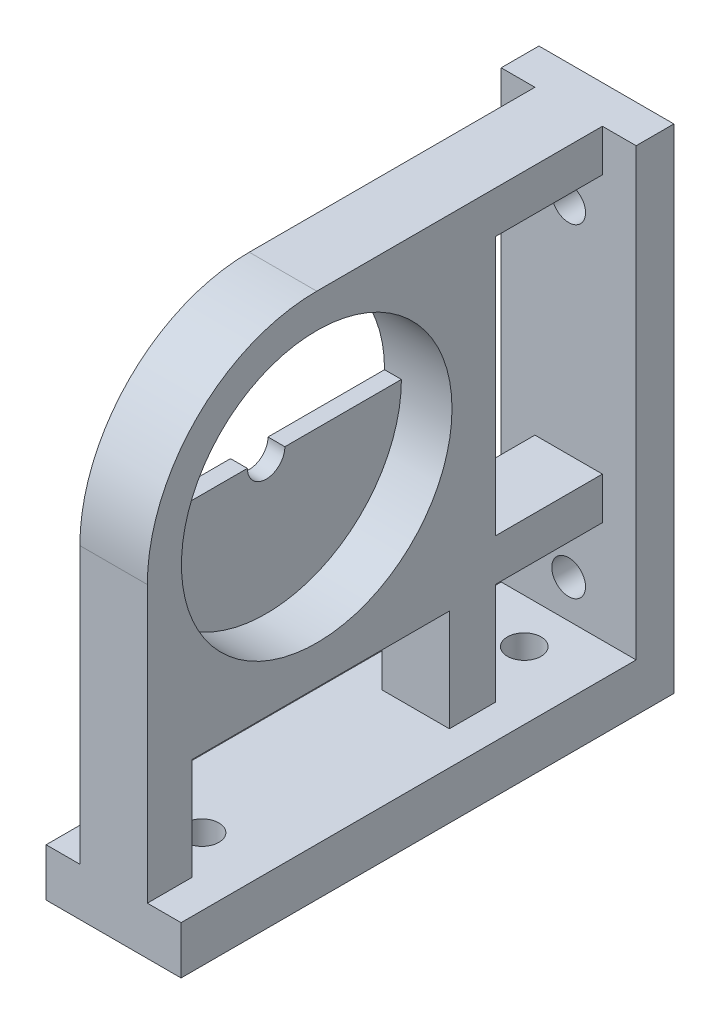
from build123d import *

# Parameters (mm, degrees)
SKETCH1_R                = 25.4635
BOSS_EXTRUDE1_DEPTH      = 12.7
BOSS_EXTRUDE2_DEPTH      = 6.35
BOSS_EXTRUDE2_DEPTH_BACK = 19.05
SKETCH4_W                = 20.078494948
SKETCH4_H                = 48.78095735
SKETCH4_W_2              = 48.420880553
SKETCH4_H_2              = 19.195923741
CUT_EXTRUDE2_DEPTH       = 26.162
SKETCH5_R                = 3.175
CUT_EXTRUDE3_DEPTH       = 11.43
SKETCH6_R                = 3.175
CUT_EXTRUDE4_DEPTH       = 11.43
BOSS_EXTRUDE3_DEPTH      = 3.175


with BuildPart() as part:
    # Sketch1 → Boss-Extrude1 (new body)
    with BuildSketch(Plane(origin=(0, 0, 0), x_dir=(0, 0, -1), z_dir=(1, 0, 0))):
        with BuildLine():
            Line((0, 31.882172919), (31.882172919, 31.882172919))
            Line((31.882172919, 31.882172919), (60.87463474, 31.882172919))
            Line((60.87463474, 31.882172919), (60.87463474, -60.96))
            Line((60.87463474, -60.96), (-31.882172919, -60.96))
            Line((-31.882172919, -60.96), (-31.882172919, 0))
            ThreePointArc((-31.882172919, 0), (-22.54410067, 22.54410067), (0, 31.882172919))
        make_face()
        Circle(SKETCH1_R, mode=Mode.SUBTRACT)
    extrude(amount=BOSS_EXTRUDE1_DEPTH)

    # Sketch8 → Boss-Extrude2 (add, two sides: drawn at the far end of the back side and taken through both)
    with BuildSketch(Plane(origin=(12.7, 0, 0), x_dir=(0, 0, -1), z_dir=(1, 0, 0)).offset(-BOSS_EXTRUDE2_DEPTH_BACK)):
        Polygon((60.87463474, 31.882172919), (53.770648903, 31.882172919), (53.770648903, -51.937867719), (-31.882172919, -51.937867719), (-31.882172919, -60.96), (53.770648903, -60.96), (60.87463474, -60.96), align=None)
    extrude(amount=BOSS_EXTRUDE2_DEPTH + BOSS_EXTRUDE2_DEPTH_BACK)

    # Sketch4 → Cut-Extrude2 (cut)
    with BuildSketch(Plane.ZY):
        with Locations((-43.731401429, -0.427222634)):
            Rectangle(SKETCH4_W, SKETCH4_H)
        with Locations((-0.75610861, -42.339905849)):
            Rectangle(SKETCH4_W_2, SKETCH4_H_2)
        with Locations((-43.731401429, -42.339905849)):
            Rectangle(SKETCH4_W, SKETCH4_H_2)
    extrude(amount=-CUT_EXTRUDE2_DEPTH, mode=Mode.SUBTRACT)

    # Sketch5 → Cut-Extrude3 (cut)
    with BuildSketch(Plane(origin=(0, 0, -60.87463474), x_dir=(-1, 0, 0), z_dir=(0, 0, -1))):
        with Locations((-6.35, 16.187024645)):
            Circle(SKETCH5_R)
        with Locations((-6.35, -44.788648077)):
            Circle(SKETCH5_R)
    extrude(amount=-CUT_EXTRUDE3_DEPTH, mode=Mode.SUBTRACT)

    # Sketch6 → Cut-Extrude4 (cut)
    with BuildSketch(Plane.XZ.offset(60.96)):
        with Locations((6.35, 15.24)):
            Circle(SKETCH6_R)
        with Locations((6.35, -45.41055385)):
            Circle(SKETCH6_R)
    extrude(amount=-CUT_EXTRUDE4_DEPTH, mode=Mode.SUBTRACT)

    # Sketch12 → Boss-Extrude3 (add)
    with BuildSketch(Plane.ZY):
        with BuildLine():
            Line((25.4635, 0), (3.527282235, 0))
            ThreePointArc((3.527282235, 0), (0, -3.527282235), (-3.527282235, 0))
            Line((-3.527282235, 0), (-25.4635, 0))
            ThreePointArc((-25.4635, 0), (0, -25.4635), (25.4635, 0))
        make_face()
    extrude(amount=-BOSS_EXTRUDE3_DEPTH)


solid = part.part
